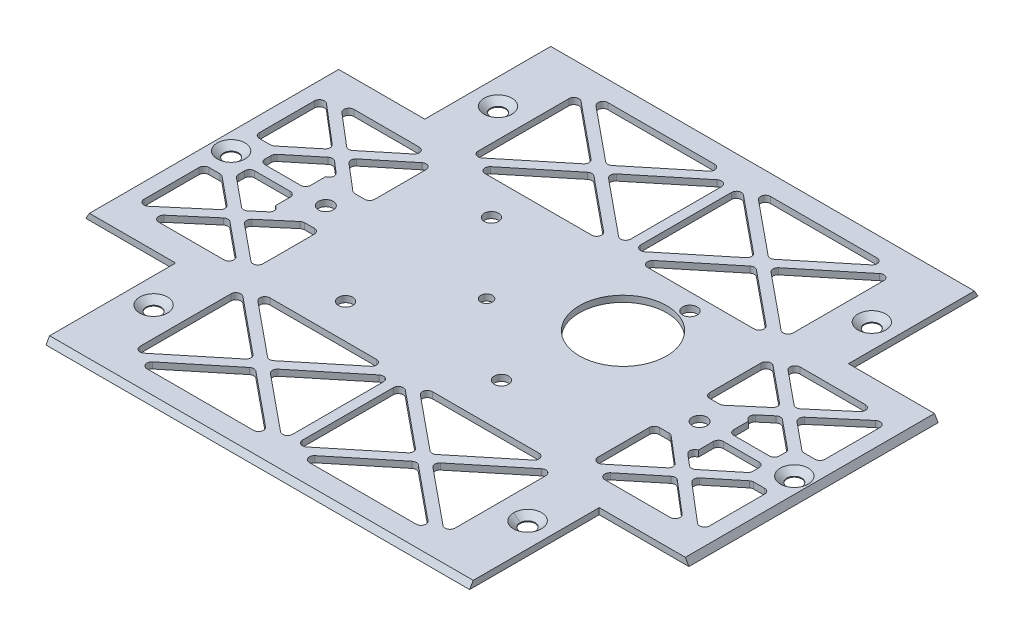
from build123d import *

# Parameters (mm, degrees)
SKETCH1_R                                 = 1.5
SKETCH1_R_2                               = 11.1125
SKETCH1_R_3                               = 1.89865
BOSS_EXTRUDE1_DEPTH                       = 1.5875
CSK_FOR_6_FLAT_HEAD_MACHINE_SCREW_2_COUNT = 2
CSK_FOR_6_FLAT_HEAD_MACHINE_SCREW_2_PITCH = 143.51
CSK_FOR_6_FLAT_HEAD_MACHINE_SCREW_3_COUNT = 2
CSK_FOR_6_FLAT_HEAD_MACHINE_SCREW_3_PITCH = 127.189783123
CSK_FOR_6_FLAT_HEAD_MACHINE_SCREW_4_COUNT = 2
CSK_FOR_6_FLAT_HEAD_MACHINE_SCREW_4_PITCH = 50.079071785
CSK_FOR_6_FLAT_HEAD_MACHINE_SCREW_5_COUNT = 2
CSK_FOR_6_FLAT_HEAD_MACHINE_SCREW_5_PITCH = 50.020107207
CSK_FOR_6_FLAT_HEAD_MACHINE_SCREW_6_COUNT = 2
CSK_FOR_6_FLAT_HEAD_MACHINE_SCREW_6_PITCH = 50.079071785
CSK_FOR_6_FLAT_HEAD_MACHINE_SCREW_7_COUNT = 2
CSK_FOR_6_FLAT_HEAD_MACHINE_SCREW_7_PITCH = 127.189783123
CUT_EXTRUDE6_DEPTH                        = 187.394464447
CUT_EXTRUDE7_DEPTH                        = 187.394464447
CUT_EXTRUDE8_DEPTH                        = 159.642852693
CUT_EXTRUDE9_DEPTH                        = 159.642852693
F_6_CLEARANCE_HOLE1_D                     = 3.6576
CUT_EXTRUDE12_DEPTH                       = 2.54
FILLET1_R                                 = 1.27
FILLET1_OF_MIRROR1_R                      = 1.27
MIRROR2_DEPTH                             = 1.5875


# Read off the part's stored shape, not the designer's step: Mirror2
with BuildPart() as part:
    # Sketch1 → Boss-Extrude1 (new body)
    with BuildSketch(Plane(origin=(0, 0, 0), x_dir=(1, 0, 0), z_dir=(0, 1, 0))):
        Polygon((27.777489681, 99.754696837), (4.917489681, 99.754696837), (4.917489681, 132.774696837), (-103.032510319, 132.774696837), (-103.032510319, 99.754696837), (-125.892510319, 99.754696837), (-125.892510319, 36.254696837), (-103.032510319, 36.254696837), (-103.032510319, 3.234696837), (4.917489681, 3.234696837), (4.917489681, 36.254696837), (27.777489681, 36.254696837), align=None)
        with Locations(Location((-55.534510319, 68.004696837, 0), (0, 0, 270))):
            Circle(SKETCH1_R, mode=Mode.SUBTRACT)
        with Locations(Location((-31.068010319, 78.308385275, 0), (0, 0, 270))):
            Circle(SKETCH1_R_2, mode=Mode.SUBTRACT)
        with Locations(Location((-1.305510319, 68.064393675, 0), (0, 0, 270))):
            Circle(SKETCH1_R_3, mode=Mode.SUBTRACT)
        with Locations(Location((-96.555510319, 68.064393675, 0), (0, 0, 270))):
            Circle(SKETCH1_R_3, mode=Mode.SUBTRACT)
    extrude(amount=BOSS_EXTRUDE1_DEPTH)

    # Sketch3 → CSK for #6 Flat Head Machine Screw (100)1 (revolve, cut)
    with BuildSketch(Plane(origin=(22.824489681, 1.5875, -68.064393675), x_dir=(0, 0, 1), z_dir=(1, 0, 0))):
        Polygon((0, 0), (0, 1.5875), (1.89865, 1.5875), (1.89865, 1.380025208), (3.5433, 0), align=None)
    csk_for_6_flat_head_machine_screw_100 = revolve(axis=Axis((22.824489681, 7.9375, -68.064393675), (0, -1, 0)), mode=Mode.SUBTRACT)

    # CSK for _6 Flat Head Machine Screw _ 2: CSK for #6 Flat Head Machine Screw (100)1 ×2
    with Locations(*[(-i * CSK_FOR_6_FLAT_HEAD_MACHINE_SCREW_2_PITCH, 0, 0) for i in range(1, CSK_FOR_6_FLAT_HEAD_MACHINE_SCREW_2_COUNT)]):
        add(csk_for_6_flat_head_machine_screw_100, mode=Mode.SUBTRACT)

    # CSK for _6 Flat Head Machine Screw _ 3: CSK for #6 Flat Head Machine Screw (100)1 ×2
    with Locations(*[Vector(-0.9385974019991601, 0, -0.3450143721070576) * (i * CSK_FOR_6_FLAT_HEAD_MACHINE_SCREW_3_PITCH) for i in range(1, CSK_FOR_6_FLAT_HEAD_MACHINE_SCREW_3_COUNT)]):
        add(csk_for_6_flat_head_machine_screw_100, mode=Mode.SUBTRACT)

    # CSK for _6 Flat Head Machine Screw _ 4: CSK for #6 Flat Head Machine Screw (100)1 ×2
    with Locations(*[Vector(-0.48183800417802863, 0, -0.8762603139077646) * (i * CSK_FOR_6_FLAT_HEAD_MACHINE_SCREW_4_PITCH) for i in range(1, CSK_FOR_6_FLAT_HEAD_MACHINE_SCREW_4_COUNT)]):
        add(csk_for_6_flat_head_machine_screw_100, mode=Mode.SUBTRACT)

    # CSK for _6 Flat Head Machine Screw _ 5: CSK for #6 Flat Head Machine Screw (100)1 ×2
    with Locations(*[Vector(-0.48240600325266964, 0, 0.8759477427482677) * (i * CSK_FOR_6_FLAT_HEAD_MACHINE_SCREW_5_PITCH) for i in range(1, CSK_FOR_6_FLAT_HEAD_MACHINE_SCREW_5_COUNT)]):
        add(csk_for_6_flat_head_machine_screw_100, mode=Mode.SUBTRACT)

    # CSK for _6 Flat Head Machine Screw _ 6: CSK for #6 Flat Head Machine Screw (100)1 ×2
    with Locations(*[Vector(-0.4818380041780274, 0, 0.8762603139077653) * (i * CSK_FOR_6_FLAT_HEAD_MACHINE_SCREW_6_PITCH) for i in range(1, CSK_FOR_6_FLAT_HEAD_MACHINE_SCREW_6_COUNT)]):
        add(csk_for_6_flat_head_machine_screw_100, mode=Mode.SUBTRACT)

    # CSK for _6 Flat Head Machine Screw _ 7: CSK for #6 Flat Head Machine Screw (100)1 ×2
    with Locations(*[Vector(-0.938597401999161, 0, 0.34501437210705527) * (i * CSK_FOR_6_FLAT_HEAD_MACHINE_SCREW_7_PITCH) for i in range(1, CSK_FOR_6_FLAT_HEAD_MACHINE_SCREW_7_COUNT)]):
        add(csk_for_6_flat_head_machine_screw_100, mode=Mode.SUBTRACT)

    # Sketch8 → Cut-Extrude6 (cut, through all)
    with BuildSketch(Plane(origin=(4.917489681, 0, 0), x_dir=(0, 0, -1), z_dir=(1, 0, 0))):
        Polygon((132.774696837, 0), (131.858153285, 1.5875), (132.774696837, 1.5875), align=None)
    extrude(amount=-CUT_EXTRUDE6_DEPTH, mode=Mode.SUBTRACT)

    # Sketch9 → Cut-Extrude7 (cut, through all)
    with BuildSketch(Plane(origin=(4.917489681, 0, 0), x_dir=(0, 0, -1), z_dir=(1, 0, 0))):
        Polygon((3.234696837, 0), (4.15124039, 1.5875), (3.234696837, 1.5875), align=None)
    extrude(amount=-CUT_EXTRUDE7_DEPTH, mode=Mode.SUBTRACT)

    # Sketch10 → Cut-Extrude8 (cut, through all)
    with BuildSketch(Plane.XY.offset(-36.254696837)):
        Polygon((-125.892510319, 0), (-124.975966766, 1.5875), (-125.892510319, 1.5875), align=None)
    extrude(amount=-CUT_EXTRUDE8_DEPTH, mode=Mode.SUBTRACT)

    # Sketch11 → Cut-Extrude9 (cut, through all)
    with BuildSketch(Plane.XY.offset(-36.254696837)):
        Polygon((27.777489681, 0), (26.860946129, 1.5875), (27.777489681, 1.5875), align=None)
    extrude(amount=-CUT_EXTRUDE9_DEPTH, mode=Mode.SUBTRACT)

    # #6 Clearance Hole1 (through all)
    with Locations(Plane(origin=(0, 1.5875, 0), x_dir=(1, 0, 0), z_dir=(0, 1, 0))):
        with Locations((-96.555510319, 24.182090512), (-72.908825938, 49.447641414), (-35.665374097, 51.922101675), (-1.305510319, 24.182090512), (-26.926442338, 91.200113333), (-72.874212511, 86.57747529), (-96.555510319, 111.946696837), (-1.305510319, 111.946696837)):
            Hole(F_6_CLEARANCE_HOLE1_D / 2)

    # Sketch17 → Cut-Extrude12 (cut)
    with BuildSketch(Plane(origin=(0, 1.5875, 0), x_dir=(1, 0, 0), z_dir=(0, 1, 0))):
        Polygon((-11.214289188, 126.742196837), (-45.498731449, 126.742196837), (-28.356510319, 112.72178858), align=None)
        Polygon((-30.362508382, 111.081107854), (-47.787510319, 125.332798995), (-47.787510319, 96.829416712), align=None)
        Polygon((-8.925510319, 125.332798995), (-26.350512255, 111.081107854), (-8.925510319, 96.829416712), align=None)
        Polygon((-11.214289188, 95.42001887), (-28.356510319, 109.440427127), (-45.498731449, 95.42001887), align=None)
        Polygon((5.996930497, 81.343177558), (-6.385510319, 91.470621028), (-6.385510319, 74.414393675), (-2.149673792, 74.414393675), align=None)
        Polygon((19.561515927, 92.88001887), (-4.096731449, 92.88001887), (7.963702644, 83.015940671), align=None)
        Polygon((16.474489681, 72.773712948), (7.995517321, 79.708558392), (1.770836956, 74.414393675), (4.850871649, 74.414393675), (4.850871649, 69.334393675), (16.474489681, 69.334393675), align=None)
        Polygon((23.014989681, 74.414393675), (23.014989681, 92.48279835), (9.962289468, 81.381321505), (18.480487745, 74.414393675), align=None)
    cut_extrude12 = extrude(amount=-CUT_EXTRUDE12_DEPTH, mode=Mode.SUBTRACT)

    # Fillet1
    # the kernel refuses this fillet: 1.27 mm, written as the material it adds along each edge
    with BuildSketch(Plane(origin=(-28.356510319, 1.5875, -109.440427127), x_dir=(0.7740689456064253, 0, 0.6331013089922947), z_dir=(0, -1, 0))) as fillet1_piece_1:
        with BuildLine():
            CenterArc((FILLET1_R * 0.817887492562, FILLET1_R), FILLET1_R, 191.441392135, 78.558607865)
            Line((-FILLET1_R * 0.162240632865, FILLET1_R * 0.801634534895), (-FILLET1_R * 0.181843195374, FILLET1_R * 0.797667225593))
            Line((-FILLET1_R * 0.181843195374, FILLET1_R * 0.797667225593), (-FILLET1_R * 0.0163577498512, -FILLET1_R * 0.02))
            Line((-FILLET1_R * 0.0163577498512, -FILLET1_R * 0.02), (FILLET1_R * 0.817887492562, -FILLET1_R * 0.02))
            Line((FILLET1_R * 0.817887492562, -FILLET1_R * 0.02), (FILLET1_R * 0.817887492562, 0))
        make_face()
    extrude(amount=1.5875)
    with BuildSketch(Plane(origin=(-11.214289188, 1.5875, -95.42001887), x_dir=(-1, 0, 0), z_dir=(0, -1, 0)), Plane(origin=(-11.214289188, 1.5875, -126.742196837), x_dir=(-0.7740689456064334, 0, 0.6331013089922848), z_dir=(0, -1, 0)), Plane(origin=(-45.498731449, 1.5875, -126.742196837), x_dir=(1, 0, 0), z_dir=(0, -1, 0)), Plane(origin=(-4.096731449, 1.5875, -92.88001887), x_dir=(1, 0, 0), z_dir=(0, -1, 0))) as fillet1_piece_2:
        with BuildLine():
            CenterArc((FILLET1_R * 2.8021880865, FILLET1_R), FILLET1_R, 129.279303932, 140.720696068)
            Line((FILLET1_R * 2.16908677751, FILLET1_R * 1.77406894561), (FILLET1_R * 2.15642475133, FILLET1_R * 1.78955032452))
            Line((FILLET1_R * 2.15642475133, FILLET1_R * 1.78955032452), (-FILLET1_R * 0.0126620261798, FILLET1_R * 0.0154813789121))
            Line((-FILLET1_R * 0.0126620261798, FILLET1_R * 0.0154813789121), (0, -FILLET1_R * 0.02))
            Line((0, -FILLET1_R * 0.02), (FILLET1_R * 2.8021880865, -FILLET1_R * 0.02))
            Line((FILLET1_R * 2.8021880865, -FILLET1_R * 0.02), (FILLET1_R * 2.8021880865, 0))
        make_face()
    extrude(amount=1.5875)
    with BuildSketch(Plane(origin=(-45.498731449, 1.5875, -95.42001887), x_dir=(1, 0, 0), z_dir=(0, -1, 0))) as fillet1_piece_3:
        with BuildLine():
            CenterArc((FILLET1_R * 2.8021880865, -FILLET1_R), FILLET1_R, 90, 140.720696068)
            Line((FILLET1_R * 2.16908677751, -FILLET1_R * 1.77406894561), (FILLET1_R * 2.15642475133, -FILLET1_R * 1.78955032452))
            Line((FILLET1_R * 2.15642475133, -FILLET1_R * 1.78955032452), (-FILLET1_R * 0.0126620261798, -FILLET1_R * 0.0154813789121))
            Line((-FILLET1_R * 0.0126620261798, -FILLET1_R * 0.0154813789121), (0, FILLET1_R * 0.02))
            Line((0, FILLET1_R * 0.02), (FILLET1_R * 2.8021880865, FILLET1_R * 0.02))
            Line((FILLET1_R * 2.8021880865, FILLET1_R * 0.02), (FILLET1_R * 2.8021880865, 0))
        make_face()
    extrude(amount=1.5875)
    with BuildSketch(Plane(origin=(-47.787510319, 1.5875, -125.332798995), x_dir=(0.774068945606431, 0, 0.6331013089922877), z_dir=(0, -1, 0)), Plane(origin=(-47.787510319, 1.5875, -96.829416712), x_dir=(0, 0, -1), z_dir=(0, -1, 0)), Plane(origin=(-8.925510319, 1.5875, -96.829416712), x_dir=(-0.7740689456064376, 0, -0.6331013089922797), z_dir=(0, -1, 0)), Plane(origin=(-6.385510319, 1.5875, -91.470621028), x_dir=(0.7740689456064331, 0, 0.633101308992285), z_dir=(0, -1, 0))) as fillet1_piece_4:
        with BuildLine():
            CenterArc((FILLET1_R * 2.10976208032, FILLET1_R), FILLET1_R, 140.720696068, 129.279303932)
            Line((FILLET1_R * 1.33569313471, FILLET1_R * 1.63310130899), (FILLET1_R * 1.3202117558, FILLET1_R * 1.64576333517))
            Line((FILLET1_R * 1.3202117558, FILLET1_R * 1.64576333517), (-FILLET1_R * 0.0154813789121, FILLET1_R * 0.0126620261798))
            Line((-FILLET1_R * 0.0154813789121, FILLET1_R * 0.0126620261798), (0, -FILLET1_R * 0.02))
            Line((0, -FILLET1_R * 0.02), (FILLET1_R * 2.10976208032, -FILLET1_R * 0.02))
            Line((FILLET1_R * 2.10976208032, -FILLET1_R * 0.02), (FILLET1_R * 2.10976208032, 0))
        make_face()
    extrude(amount=1.5875)
    with BuildSketch(Plane(origin=(-30.362508382, 1.5875, -111.081107854), x_dir=(-0.7740689456064327, 0, -0.6331013089922857), z_dir=(0, -1, 0))) as fillet1_piece_5:
        with BuildLine():
            CenterArc((FILLET1_R * 1.22266205205, -FILLET1_R), FILLET1_R, 90, 101.441392135)
            Line((FILLET1_R * 0.24253392662, -FILLET1_R * 1.1983654651), (FILLET1_R * 0.222931364111, -FILLET1_R * 1.20233277441))
            Line((FILLET1_R * 0.222931364111, -FILLET1_R * 1.20233277441), (-FILLET1_R * 0.0244532410409, FILLET1_R * 0.02))
            Line((-FILLET1_R * 0.0244532410409, FILLET1_R * 0.02), (FILLET1_R * 1.22266205205, FILLET1_R * 0.02))
            Line((FILLET1_R * 1.22266205205, FILLET1_R * 0.02), (FILLET1_R * 1.22266205205, 0))
        make_face()
    extrude(amount=1.5875)
    with BuildSketch(Plane(origin=(-28.356510319, 1.5875, -112.72178858), x_dir=(0.7740689456064334, 0, -0.6331013089922848), z_dir=(0, -1, 0))) as fillet1_piece_6:
        with BuildLine():
            CenterArc((FILLET1_R * 0.817887492562, -FILLET1_R), FILLET1_R, 90, 78.558607865)
            Line((-FILLET1_R * 0.162240632865, -FILLET1_R * 0.801634534895), (-FILLET1_R * 0.181843195374, -FILLET1_R * 0.797667225593))
            Line((-FILLET1_R * 0.181843195374, -FILLET1_R * 0.797667225593), (-FILLET1_R * 0.0163577498512, FILLET1_R * 0.02))
            Line((-FILLET1_R * 0.0163577498512, FILLET1_R * 0.02), (FILLET1_R * 0.817887492562, FILLET1_R * 0.02))
            Line((FILLET1_R * 0.817887492562, FILLET1_R * 0.02), (FILLET1_R * 0.817887492562, 0))
        make_face()
    extrude(amount=1.5875)
    with BuildSketch(Plane(origin=(-8.925510319, 1.5875, -125.332798995), x_dir=(-0.7740689456064339, 0, 0.633101308992284), z_dir=(0, -1, 0))) as fillet1_piece_7:
        with BuildLine():
            CenterArc((FILLET1_R * 2.10976208032, -FILLET1_R), FILLET1_R, 90, 129.279303932)
            Line((FILLET1_R * 1.33569313471, -FILLET1_R * 1.63310130899), (FILLET1_R * 1.3202117558, -FILLET1_R * 1.64576333517))
            Line((FILLET1_R * 1.3202117558, -FILLET1_R * 1.64576333517), (-FILLET1_R * 0.0154813789121, -FILLET1_R * 0.0126620261798))
            Line((-FILLET1_R * 0.0154813789121, -FILLET1_R * 0.0126620261798), (0, FILLET1_R * 0.02))
            Line((0, FILLET1_R * 0.02), (FILLET1_R * 2.10976208032, FILLET1_R * 0.02))
            Line((FILLET1_R * 2.10976208032, FILLET1_R * 0.02), (FILLET1_R * 2.10976208032, 0))
        make_face()
    extrude(amount=1.5875)
    with BuildSketch(Plane(origin=(-26.350512255, 1.5875, -111.081107854), x_dir=(0.7740689456064362, 0, -0.6331013089922812), z_dir=(0, -1, 0))) as fillet1_piece_8:
        with BuildLine():
            CenterArc((FILLET1_R * 1.22266205205, FILLET1_R), FILLET1_R, 168.558607865, 101.441392135)
            Line((FILLET1_R * 0.24253392662, FILLET1_R * 1.1983654651), (FILLET1_R * 0.222931364111, FILLET1_R * 1.20233277441))
            Line((FILLET1_R * 0.222931364111, FILLET1_R * 1.20233277441), (-FILLET1_R * 0.0244532410409, -FILLET1_R * 0.02))
            Line((-FILLET1_R * 0.0244532410409, -FILLET1_R * 0.02), (FILLET1_R * 1.22266205205, -FILLET1_R * 0.02))
            Line((FILLET1_R * 1.22266205205, -FILLET1_R * 0.02), (FILLET1_R * 1.22266205205, 0))
        make_face()
    extrude(amount=1.5875)
    with BuildSketch(Plane(origin=(7.963702644, 1.5875, -83.015940671), x_dir=(0.761746862196503, 0, -0.6478747702556271), z_dir=(0, -1, 0))) as fillet1_piece_9:
        with BuildLine():
            CenterArc((FILLET1_R * 0.834068820453, -FILLET1_R), FILLET1_R, 90, 79.660863576)
            Line((-FILLET1_R * 0.149693855421, -FILLET1_R * 0.820525774672), (-FILLET1_R * 0.169369108938, -FILLET1_R * 0.816936290166))
            Line((-FILLET1_R * 0.169369108938, -FILLET1_R * 0.816936290166), (-FILLET1_R * 0.0166813764091, FILLET1_R * 0.02))
            Line((-FILLET1_R * 0.0166813764091, FILLET1_R * 0.02), (FILLET1_R * 0.834068820453, FILLET1_R * 0.02))
            Line((FILLET1_R * 0.834068820453, FILLET1_R * 0.02), (FILLET1_R * 0.834068820453, 0))
        make_face()
    extrude(amount=1.5875)
    with BuildSketch(Plane(origin=(19.561515927, 1.5875, -92.88001887), x_dir=(-0.7617468621965059, 0, 0.6478747702556239), z_dir=(0, -1, 0))) as fillet1_piece_10:
        with BuildLine():
            CenterArc((FILLET1_R * 2.71927067248, FILLET1_R), FILLET1_R, 130.381559644, 139.618440356)
            Line((FILLET1_R * 2.07139590223, FILLET1_R * 1.7617468622), (FILLET1_R * 2.05843840682, FILLET1_R * 1.77698179944))
            Line((FILLET1_R * 2.05843840682, FILLET1_R * 1.77698179944), (-FILLET1_R * 0.0129574954051, FILLET1_R * 0.0152349372439))
            Line((-FILLET1_R * 0.0129574954051, FILLET1_R * 0.0152349372439), (0, -FILLET1_R * 0.02))
            Line((0, -FILLET1_R * 0.02), (FILLET1_R * 2.71927067248, -FILLET1_R * 0.02))
            Line((FILLET1_R * 2.71927067248, -FILLET1_R * 0.02), (FILLET1_R * 2.71927067248, 0))
        make_face()
    extrude(amount=1.5875)
    with BuildSketch(Plane(origin=(-2.149673792, 1.5875, -74.414393675), x_dir=(-1, 0, 0), z_dir=(0, -1, 0))) as fillet1_piece_11:
        with BuildLine():
            CenterArc((FILLET1_R * 0.36774566435, FILLET1_R), FILLET1_R, 229.618440356, 40.381559644)
            Line((-FILLET1_R * 0.280129105905, FILLET1_R * 0.238253137803), (-FILLET1_R * 0.29308660131, FILLET1_R * 0.22301820056))
            Line((-FILLET1_R * 0.29308660131, FILLET1_R * 0.22301820056), (-FILLET1_R * 0.00735491328701, -FILLET1_R * 0.02))
            Line((-FILLET1_R * 0.00735491328701, -FILLET1_R * 0.02), (FILLET1_R * 0.36774566435, -FILLET1_R * 0.02))
            Line((FILLET1_R * 0.36774566435, -FILLET1_R * 0.02), (FILLET1_R * 0.36774566435, 0))
        make_face()
    extrude(amount=1.5875)
    with BuildSketch(Plane(origin=(-6.385510319, 1.5875, -74.414393675), x_dir=(0, 0, -1), z_dir=(0, -1, 0)), Plane(origin=(16.474489681, 1.5875, -69.334393675), x_dir=(-1, 0, 0), z_dir=(0, -1, 0)), Plane(origin=(23.014989681, 1.5875, -74.414393675), x_dir=(-1, 0, 0), z_dir=(0, -1, 0))) as fillet1_piece_12:
        with BuildLine():
            CenterArc((FILLET1_R, FILLET1_R), FILLET1_R, 180, 90)
            Line((0, FILLET1_R), (-FILLET1_R * 0.02, FILLET1_R))
            Line((-FILLET1_R * 0.02, FILLET1_R), (-FILLET1_R * 0.02, -FILLET1_R * 0.02))
            Line((-FILLET1_R * 0.02, -FILLET1_R * 0.02), (FILLET1_R, -FILLET1_R * 0.02))
            Line((FILLET1_R, -FILLET1_R * 0.02), (FILLET1_R, 0))
        make_face()
    extrude(amount=1.5875)
    with BuildSketch(Plane(origin=(5.996930497, 1.5875, -81.343177558), x_dir=(-0.7740689456064349, 0, -0.6331013089922829), z_dir=(0, -1, 0)), Plane(origin=(9.962289468, 1.5875, -81.381321505), x_dir=(0.7740689456064364, 0, 0.6331013089922812), z_dir=(0, -1, 0))) as fillet1_piece_13:
        with BuildLine():
            CenterArc((FILLET1_R * 1.19894183247, -FILLET1_R), FILLET1_R, 90, 100.339136424)
            Line((FILLET1_R * 0.215179156595, -FILLET1_R * 1.17947422533), (FILLET1_R * 0.195503903078, -FILLET1_R * 1.18306370983))
            Line((FILLET1_R * 0.195503903078, -FILLET1_R * 1.18306370983), (-FILLET1_R * 0.0239788366494, FILLET1_R * 0.02))
            Line((-FILLET1_R * 0.0239788366494, FILLET1_R * 0.02), (FILLET1_R * 1.19894183247, FILLET1_R * 0.02))
            Line((FILLET1_R * 1.19894183247, FILLET1_R * 0.02), (FILLET1_R * 1.19894183247, 0))
        make_face()
    extrude(amount=1.5875)
    with BuildSketch(Plane(origin=(1.770836956, 1.5875, -74.414393675), x_dir=(0.761746862196506, 0, -0.6478747702556238), z_dir=(0, -1, 0))) as fillet1_piece_14:
        with BuildLine():
            CenterArc((3.388599902, 1.27), FILLET1_R, 145.163151705, 124.836848295)
            Line((2.346206763, 1.995476769), (2.3253589, 2.009986304))
            ThreePointArc((2.3253589, 2.009986304), (1.156647362, 1.017086755), (-0.016456019, 0.01934837))
            Line((-0.016456019, 0.01934837), (0, -0.0254))
            Line((0, -0.0254), (3.388599902, -0.0254))
            Line((3.388599902, -0.0254), (3.388599902, 0))
        make_face()
    extrude(amount=1.5875)
    with BuildSketch(Plane(origin=(7.995517321, 1.5875, -79.708558392), x_dir=(0.7740689456064308, 0, 0.633101308992288), z_dir=(0, -1, 0))) as fillet1_piece_15:
        with BuildLine():
            CenterArc((FILLET1_R * 0.834068820453, FILLET1_R), FILLET1_R, 190.339136424, 79.660863576)
            Line((-FILLET1_R * 0.149693855421, FILLET1_R * 0.820525774672), (-FILLET1_R * 0.169369108938, FILLET1_R * 0.816936290166))
            Line((-FILLET1_R * 0.169369108938, FILLET1_R * 0.816936290166), (-FILLET1_R * 0.0166813764091, -FILLET1_R * 0.02))
            Line((-FILLET1_R * 0.0166813764091, -FILLET1_R * 0.02), (FILLET1_R * 0.834068820453, -FILLET1_R * 0.02))
            Line((FILLET1_R * 0.834068820453, -FILLET1_R * 0.02), (FILLET1_R * 0.834068820453, 0))
        make_face()
    extrude(amount=1.5875)
    with BuildSketch(Plane(origin=(16.474489681, 1.5875, -72.773712948), x_dir=(0, 0, 1), z_dir=(0, -1, 0))) as fillet1_piece_16:
        with BuildLine():
            CenterArc((FILLET1_R * 0.473987095194, FILLET1_R), FILLET1_R, 219.279303932, 50.720696068)
            Line((-FILLET1_R * 0.300081850413, FILLET1_R * 0.366898691008), (-FILLET1_R * 0.315563229325, FILLET1_R * 0.354236664828))
            Line((-FILLET1_R * 0.315563229325, FILLET1_R * 0.354236664828), (-FILLET1_R * 0.00947974190387, -FILLET1_R * 0.02))
            Line((-FILLET1_R * 0.00947974190387, -FILLET1_R * 0.02), (FILLET1_R * 0.473987095194, -FILLET1_R * 0.02))
            Line((FILLET1_R * 0.473987095194, -FILLET1_R * 0.02), (FILLET1_R * 0.473987095194, 0))
        make_face()
    extrude(amount=1.5875)
    with BuildSketch(Plane(origin=(4.850871649, 1.5875, -69.334393675), x_dir=(1, 0, 0), z_dir=(0, -1, 0))) as fillet1_piece_17:
        with BuildLine():
            CenterArc((FILLET1_R, -FILLET1_R), FILLET1_R, 90, 90)
            Line((0, -FILLET1_R), (-FILLET1_R * 0.02, -FILLET1_R))
            Line((-FILLET1_R * 0.02, -FILLET1_R), (-FILLET1_R * 0.02, FILLET1_R * 0.02))
            Line((-FILLET1_R * 0.02, FILLET1_R * 0.02), (FILLET1_R, FILLET1_R * 0.02))
            Line((FILLET1_R, FILLET1_R * 0.02), (FILLET1_R, 0))
        make_face()
    extrude(amount=1.5875)
    with BuildSketch(Plane(origin=(18.480487745, 1.5875, -74.414393675), x_dir=(-0.7740689456064446, 0, -0.633101308992271), z_dir=(0, -1, 0))) as fillet1_piece_18:
        with BuildLine():
            CenterArc((FILLET1_R * 0.356863982406, FILLET1_R), FILLET1_R, 230.720696068, 39.279303932)
            Line((-FILLET1_R * 0.276237326586, FILLET1_R * 0.225931054394), (-FILLET1_R * 0.288899352766, FILLET1_R * 0.210449675481))
            Line((-FILLET1_R * 0.288899352766, FILLET1_R * 0.210449675481), (-FILLET1_R * 0.00713727964813, -FILLET1_R * 0.02))
            Line((-FILLET1_R * 0.00713727964813, -FILLET1_R * 0.02), (FILLET1_R * 0.356863982406, -FILLET1_R * 0.02))
            Line((FILLET1_R * 0.356863982406, -FILLET1_R * 0.02), (FILLET1_R * 0.356863982406, 0))
        make_face()
    extrude(amount=1.5875)
    with BuildSketch(Plane(origin=(23.014989681, 1.5875, -92.48279835), x_dir=(0, 0, 1), z_dir=(0, -1, 0))) as fillet1_piece_19:
        with BuildLine():
            CenterArc((FILLET1_R * 2.16328396221, FILLET1_R), FILLET1_R, 139.618440356, 130.381559644)
            Line((FILLET1_R * 1.40153710002, FILLET1_R * 1.64787477026), (FILLET1_R * 1.38630216277, FILLET1_R * 1.66083226566))
            Line((FILLET1_R * 1.38630216277, FILLET1_R * 1.66083226566), (-FILLET1_R * 0.0152349372439, FILLET1_R * 0.0129574954051))
            Line((-FILLET1_R * 0.0152349372439, FILLET1_R * 0.0129574954051), (0, -FILLET1_R * 0.02))
            Line((0, -FILLET1_R * 0.02), (FILLET1_R * 2.16328396221, -FILLET1_R * 0.02))
            Line((FILLET1_R * 2.16328396221, -FILLET1_R * 0.02), (FILLET1_R * 2.16328396221, 0))
        make_face()
    extrude(amount=1.5875)

    # Mirror1: Cut-Extrude12 across plane
    add(cut_extrude12.mirror(Plane(origin=(-49.057510319, 0, -132.774696837), x_dir=(0, 0, 1), z_dir=(1, 0, 0))), mode=Mode.SUBTRACT)

    # Fillet1 of Mirror1
    # the kernel refuses this fillet: 1.27 mm, written as the material it adds along each edge
    with BuildSketch(Plane(origin=(-69.758510319, 1.5875, -109.440427127), x_dir=(0.7740689456064253, 0, 0.6331013089922947), z_dir=(0, -1, 0))) as fillet1_of_mirror1_piece_1:
        with BuildLine():
            CenterArc((FILLET1_OF_MIRROR1_R * 0.817887492562, FILLET1_OF_MIRROR1_R), FILLET1_OF_MIRROR1_R, 191.441392135, 78.558607865)
            Line((-FILLET1_OF_MIRROR1_R * 0.162240632865, FILLET1_OF_MIRROR1_R * 0.801634534895), (-FILLET1_OF_MIRROR1_R * 0.181843195374, FILLET1_OF_MIRROR1_R * 0.797667225593))
            Line((-FILLET1_OF_MIRROR1_R * 0.181843195374, FILLET1_OF_MIRROR1_R * 0.797667225593), (-FILLET1_OF_MIRROR1_R * 0.0163577498512, -FILLET1_OF_MIRROR1_R * 0.02))
            Line((-FILLET1_OF_MIRROR1_R * 0.0163577498512, -FILLET1_OF_MIRROR1_R * 0.02), (FILLET1_OF_MIRROR1_R * 0.817887492562, -FILLET1_OF_MIRROR1_R * 0.02))
            Line((FILLET1_OF_MIRROR1_R * 0.817887492562, -FILLET1_OF_MIRROR1_R * 0.02), (FILLET1_OF_MIRROR1_R * 0.817887492562, 0))
        make_face()
    extrude(amount=1.5875)
    with BuildSketch(Plane(origin=(-86.900731449, 1.5875, -95.42001887), x_dir=(0.7740689456064318, 0, -0.6331013089922868), z_dir=(0, -1, 0)), Plane(origin=(-86.900731449, 1.5875, -126.742196837), x_dir=(1, 0, 0), z_dir=(0, -1, 0)), Plane(origin=(-52.616289188, 1.5875, -126.742196837), x_dir=(-0.774068945606437, 0, 0.6331013089922803), z_dir=(0, -1, 0)), Plane(origin=(-94.018289188, 1.5875, -92.88001887), x_dir=(-0.7740689456064342, 0, 0.6331013089922837), z_dir=(0, -1, 0))) as fillet1_of_mirror1_piece_2:
        with BuildLine():
            CenterArc((FILLET1_OF_MIRROR1_R * 2.8021880865, FILLET1_OF_MIRROR1_R), FILLET1_OF_MIRROR1_R, 129.279303932, 140.720696068)
            Line((FILLET1_OF_MIRROR1_R * 2.16908677751, FILLET1_OF_MIRROR1_R * 1.77406894561), (FILLET1_OF_MIRROR1_R * 2.15642475133, FILLET1_OF_MIRROR1_R * 1.78955032452))
            Line((FILLET1_OF_MIRROR1_R * 2.15642475133, FILLET1_OF_MIRROR1_R * 1.78955032452), (-FILLET1_OF_MIRROR1_R * 0.0126620261798, FILLET1_OF_MIRROR1_R * 0.0154813789121))
            Line((-FILLET1_OF_MIRROR1_R * 0.0126620261798, FILLET1_OF_MIRROR1_R * 0.0154813789121), (0, -FILLET1_OF_MIRROR1_R * 0.02))
            Line((0, -FILLET1_OF_MIRROR1_R * 0.02), (FILLET1_OF_MIRROR1_R * 2.8021880865, -FILLET1_OF_MIRROR1_R * 0.02))
            Line((FILLET1_OF_MIRROR1_R * 2.8021880865, -FILLET1_OF_MIRROR1_R * 0.02), (FILLET1_OF_MIRROR1_R * 2.8021880865, 0))
        make_face()
    extrude(amount=1.5875)
    with BuildSketch(Plane(origin=(-52.616289188, 1.5875, -95.42001887), x_dir=(-0.7740689456064346, 0, -0.6331013089922835), z_dir=(0, -1, 0))) as fillet1_of_mirror1_piece_3:
        with BuildLine():
            CenterArc((FILLET1_OF_MIRROR1_R * 2.8021880865, -FILLET1_OF_MIRROR1_R), FILLET1_OF_MIRROR1_R, 90, 140.720696068)
            Line((FILLET1_OF_MIRROR1_R * 2.16908677751, -FILLET1_OF_MIRROR1_R * 1.77406894561), (FILLET1_OF_MIRROR1_R * 2.15642475133, -FILLET1_OF_MIRROR1_R * 1.78955032452))
            Line((FILLET1_OF_MIRROR1_R * 2.15642475133, -FILLET1_OF_MIRROR1_R * 1.78955032452), (-FILLET1_OF_MIRROR1_R * 0.0126620261798, -FILLET1_OF_MIRROR1_R * 0.0154813789121))
            Line((-FILLET1_OF_MIRROR1_R * 0.0126620261798, -FILLET1_OF_MIRROR1_R * 0.0154813789121), (0, FILLET1_OF_MIRROR1_R * 0.02))
            Line((0, FILLET1_OF_MIRROR1_R * 0.02), (FILLET1_OF_MIRROR1_R * 2.8021880865, FILLET1_OF_MIRROR1_R * 0.02))
            Line((FILLET1_OF_MIRROR1_R * 2.8021880865, FILLET1_OF_MIRROR1_R * 0.02), (FILLET1_OF_MIRROR1_R * 2.8021880865, 0))
        make_face()
    extrude(amount=1.5875)
    with BuildSketch(Plane(origin=(-50.327510319, 1.5875, -125.332798995), x_dir=(0, 0, 1), z_dir=(0, -1, 0)), Plane(origin=(-50.327510319, 1.5875, -96.829416712), x_dir=(-0.7740689456064358, 0, -0.6331013089922819), z_dir=(0, -1, 0)), Plane(origin=(-89.189510319, 1.5875, -96.829416712), x_dir=(0, 0, -1), z_dir=(0, -1, 0)), Plane(origin=(-91.729510319, 1.5875, -91.470621028), x_dir=(0, 0, 1), z_dir=(0, -1, 0))) as fillet1_of_mirror1_piece_4:
        with BuildLine():
            CenterArc((FILLET1_OF_MIRROR1_R * 2.10976208032, FILLET1_OF_MIRROR1_R), FILLET1_OF_MIRROR1_R, 140.720696068, 129.279303932)
            Line((FILLET1_OF_MIRROR1_R * 1.33569313471, FILLET1_OF_MIRROR1_R * 1.63310130899), (FILLET1_OF_MIRROR1_R * 1.3202117558, FILLET1_OF_MIRROR1_R * 1.64576333517))
            Line((FILLET1_OF_MIRROR1_R * 1.3202117558, FILLET1_OF_MIRROR1_R * 1.64576333517), (-FILLET1_OF_MIRROR1_R * 0.0154813789121, FILLET1_OF_MIRROR1_R * 0.0126620261798))
            Line((-FILLET1_OF_MIRROR1_R * 0.0154813789121, FILLET1_OF_MIRROR1_R * 0.0126620261798), (0, -FILLET1_OF_MIRROR1_R * 0.02))
            Line((0, -FILLET1_OF_MIRROR1_R * 0.02), (FILLET1_OF_MIRROR1_R * 2.10976208032, -FILLET1_OF_MIRROR1_R * 0.02))
            Line((FILLET1_OF_MIRROR1_R * 2.10976208032, -FILLET1_OF_MIRROR1_R * 0.02), (FILLET1_OF_MIRROR1_R * 2.10976208032, 0))
        make_face()
    extrude(amount=1.5875)
    with BuildSketch(Plane(origin=(-67.752512255, 1.5875, -111.081107854), x_dir=(0.774068945606437, 0, 0.6331013089922802), z_dir=(0, -1, 0))) as fillet1_of_mirror1_piece_5:
        with BuildLine():
            CenterArc((FILLET1_OF_MIRROR1_R * 1.22266205205, -FILLET1_OF_MIRROR1_R), FILLET1_OF_MIRROR1_R, 90, 101.441392135)
            Line((FILLET1_OF_MIRROR1_R * 0.24253392662, -FILLET1_OF_MIRROR1_R * 1.1983654651), (FILLET1_OF_MIRROR1_R * 0.222931364111, -FILLET1_OF_MIRROR1_R * 1.20233277441))
            Line((FILLET1_OF_MIRROR1_R * 0.222931364111, -FILLET1_OF_MIRROR1_R * 1.20233277441), (-FILLET1_OF_MIRROR1_R * 0.0244532410409, FILLET1_OF_MIRROR1_R * 0.02))
            Line((-FILLET1_OF_MIRROR1_R * 0.0244532410409, FILLET1_OF_MIRROR1_R * 0.02), (FILLET1_OF_MIRROR1_R * 1.22266205205, FILLET1_OF_MIRROR1_R * 0.02))
            Line((FILLET1_OF_MIRROR1_R * 1.22266205205, FILLET1_OF_MIRROR1_R * 0.02), (FILLET1_OF_MIRROR1_R * 1.22266205205, 0))
        make_face()
    extrude(amount=1.5875)
    with BuildSketch(Plane(origin=(-69.758510319, 1.5875, -112.72178858), x_dir=(0.7740689456064332, 0, -0.633101308992285), z_dir=(0, -1, 0))) as fillet1_of_mirror1_piece_6:
        with BuildLine():
            CenterArc((FILLET1_OF_MIRROR1_R * 0.817887492562, -FILLET1_OF_MIRROR1_R), FILLET1_OF_MIRROR1_R, 90, 78.558607865)
            Line((-FILLET1_OF_MIRROR1_R * 0.162240632865, -FILLET1_OF_MIRROR1_R * 0.801634534895), (-FILLET1_OF_MIRROR1_R * 0.181843195374, -FILLET1_OF_MIRROR1_R * 0.797667225593))
            Line((-FILLET1_OF_MIRROR1_R * 0.181843195374, -FILLET1_OF_MIRROR1_R * 0.797667225593), (-FILLET1_OF_MIRROR1_R * 0.0163577498512, FILLET1_OF_MIRROR1_R * 0.02))
            Line((-FILLET1_OF_MIRROR1_R * 0.0163577498512, FILLET1_OF_MIRROR1_R * 0.02), (FILLET1_OF_MIRROR1_R * 0.817887492562, FILLET1_OF_MIRROR1_R * 0.02))
            Line((FILLET1_OF_MIRROR1_R * 0.817887492562, FILLET1_OF_MIRROR1_R * 0.02), (FILLET1_OF_MIRROR1_R * 0.817887492562, 0))
        make_face()
    extrude(amount=1.5875)
    with BuildSketch(Plane(origin=(-89.189510319, 1.5875, -125.332798995), x_dir=(0, 0, 1), z_dir=(0, -1, 0))) as fillet1_of_mirror1_piece_7:
        with BuildLine():
            CenterArc((FILLET1_OF_MIRROR1_R * 2.10976208032, -FILLET1_OF_MIRROR1_R), FILLET1_OF_MIRROR1_R, 90, 129.279303932)
            Line((FILLET1_OF_MIRROR1_R * 1.33569313471, -FILLET1_OF_MIRROR1_R * 1.63310130899), (FILLET1_OF_MIRROR1_R * 1.3202117558, -FILLET1_OF_MIRROR1_R * 1.64576333517))
            Line((FILLET1_OF_MIRROR1_R * 1.3202117558, -FILLET1_OF_MIRROR1_R * 1.64576333517), (-FILLET1_OF_MIRROR1_R * 0.0154813789121, -FILLET1_OF_MIRROR1_R * 0.0126620261798))
            Line((-FILLET1_OF_MIRROR1_R * 0.0154813789121, -FILLET1_OF_MIRROR1_R * 0.0126620261798), (0, FILLET1_OF_MIRROR1_R * 0.02))
            Line((0, FILLET1_OF_MIRROR1_R * 0.02), (FILLET1_OF_MIRROR1_R * 2.10976208032, FILLET1_OF_MIRROR1_R * 0.02))
            Line((FILLET1_OF_MIRROR1_R * 2.10976208032, FILLET1_OF_MIRROR1_R * 0.02), (FILLET1_OF_MIRROR1_R * 2.10976208032, 0))
        make_face()
    extrude(amount=1.5875)
    with BuildSketch(Plane(origin=(-71.764508382, 1.5875, -111.081107854), x_dir=(-0.7740689456064362, 0, 0.6331013089922812), z_dir=(0, -1, 0))) as fillet1_of_mirror1_piece_8:
        with BuildLine():
            CenterArc((FILLET1_OF_MIRROR1_R * 1.22266205205, FILLET1_OF_MIRROR1_R), FILLET1_OF_MIRROR1_R, 168.558607865, 101.441392135)
            Line((FILLET1_OF_MIRROR1_R * 0.24253392662, FILLET1_OF_MIRROR1_R * 1.1983654651), (FILLET1_OF_MIRROR1_R * 0.222931364111, FILLET1_OF_MIRROR1_R * 1.20233277441))
            Line((FILLET1_OF_MIRROR1_R * 0.222931364111, FILLET1_OF_MIRROR1_R * 1.20233277441), (-FILLET1_OF_MIRROR1_R * 0.0244532410409, -FILLET1_OF_MIRROR1_R * 0.02))
            Line((-FILLET1_OF_MIRROR1_R * 0.0244532410409, -FILLET1_OF_MIRROR1_R * 0.02), (FILLET1_OF_MIRROR1_R * 1.22266205205, -FILLET1_OF_MIRROR1_R * 0.02))
            Line((FILLET1_OF_MIRROR1_R * 1.22266205205, -FILLET1_OF_MIRROR1_R * 0.02), (FILLET1_OF_MIRROR1_R * 1.22266205205, 0))
        make_face()
    extrude(amount=1.5875)
    with BuildSketch(Plane(origin=(-106.078723281, 1.5875, -83.015940671), x_dir=(0.7740689456064417, 0, -0.6331013089922747), z_dir=(0, -1, 0))) as fillet1_of_mirror1_piece_9:
        with BuildLine():
            CenterArc((FILLET1_OF_MIRROR1_R * 0.834068820453, -FILLET1_OF_MIRROR1_R), FILLET1_OF_MIRROR1_R, 90, 79.660863576)
            Line((-FILLET1_OF_MIRROR1_R * 0.149693855421, -FILLET1_OF_MIRROR1_R * 0.820525774672), (-FILLET1_OF_MIRROR1_R * 0.169369108938, -FILLET1_OF_MIRROR1_R * 0.816936290166))
            Line((-FILLET1_OF_MIRROR1_R * 0.169369108938, -FILLET1_OF_MIRROR1_R * 0.816936290166), (-FILLET1_OF_MIRROR1_R * 0.0166813764091, FILLET1_OF_MIRROR1_R * 0.02))
            Line((-FILLET1_OF_MIRROR1_R * 0.0166813764091, FILLET1_OF_MIRROR1_R * 0.02), (FILLET1_OF_MIRROR1_R * 0.834068820453, FILLET1_OF_MIRROR1_R * 0.02))
            Line((FILLET1_OF_MIRROR1_R * 0.834068820453, FILLET1_OF_MIRROR1_R * 0.02), (FILLET1_OF_MIRROR1_R * 0.834068820453, 0))
        make_face()
    extrude(amount=1.5875)
    with BuildSketch(Plane(origin=(-117.676536565, 1.5875, -92.88001887), x_dir=(1, 0, 0), z_dir=(0, -1, 0))) as fillet1_of_mirror1_piece_10:
        with BuildLine():
            CenterArc((FILLET1_OF_MIRROR1_R * 2.71927067248, FILLET1_OF_MIRROR1_R), FILLET1_OF_MIRROR1_R, 130.381559644, 139.618440356)
            Line((FILLET1_OF_MIRROR1_R * 2.07139590223, FILLET1_OF_MIRROR1_R * 1.7617468622), (FILLET1_OF_MIRROR1_R * 2.05843840682, FILLET1_OF_MIRROR1_R * 1.77698179944))
            Line((FILLET1_OF_MIRROR1_R * 2.05843840682, FILLET1_OF_MIRROR1_R * 1.77698179944), (-FILLET1_OF_MIRROR1_R * 0.0129574954051, FILLET1_OF_MIRROR1_R * 0.0152349372439))
            Line((-FILLET1_OF_MIRROR1_R * 0.0129574954051, FILLET1_OF_MIRROR1_R * 0.0152349372439), (0, -FILLET1_OF_MIRROR1_R * 0.02))
            Line((0, -FILLET1_OF_MIRROR1_R * 0.02), (FILLET1_OF_MIRROR1_R * 2.71927067248, -FILLET1_OF_MIRROR1_R * 0.02))
            Line((FILLET1_OF_MIRROR1_R * 2.71927067248, -FILLET1_OF_MIRROR1_R * 0.02), (FILLET1_OF_MIRROR1_R * 2.71927067248, 0))
        make_face()
    extrude(amount=1.5875)
    with BuildSketch(Plane(origin=(-95.965346846, 1.5875, -74.414393675), x_dir=(-0.7617468621965019, 0, -0.6478747702556286), z_dir=(0, -1, 0))) as fillet1_of_mirror1_piece_11:
        with BuildLine():
            CenterArc((FILLET1_OF_MIRROR1_R * 0.36774566435, FILLET1_OF_MIRROR1_R), FILLET1_OF_MIRROR1_R, 229.618440356, 40.381559644)
            Line((-FILLET1_OF_MIRROR1_R * 0.280129105905, FILLET1_OF_MIRROR1_R * 0.238253137803), (-FILLET1_OF_MIRROR1_R * 0.29308660131, FILLET1_OF_MIRROR1_R * 0.22301820056))
            Line((-FILLET1_OF_MIRROR1_R * 0.29308660131, FILLET1_OF_MIRROR1_R * 0.22301820056), (-FILLET1_OF_MIRROR1_R * 0.00735491328701, -FILLET1_OF_MIRROR1_R * 0.02))
            Line((-FILLET1_OF_MIRROR1_R * 0.00735491328701, -FILLET1_OF_MIRROR1_R * 0.02), (FILLET1_OF_MIRROR1_R * 0.36774566435, -FILLET1_OF_MIRROR1_R * 0.02))
            Line((FILLET1_OF_MIRROR1_R * 0.36774566435, -FILLET1_OF_MIRROR1_R * 0.02), (FILLET1_OF_MIRROR1_R * 0.36774566435, 0))
        make_face()
    extrude(amount=1.5875)
    with BuildSketch(Plane(origin=(-91.729510319, 1.5875, -74.414393675), x_dir=(-1, 0, 0), z_dir=(0, -1, 0)), Plane(origin=(-114.589510319, 1.5875, -69.334393675), x_dir=(0, 0, -1), z_dir=(0, -1, 0)), Plane(origin=(-121.130010319, 1.5875, -74.414393675), x_dir=(0, 0, -1), z_dir=(0, -1, 0))) as fillet1_of_mirror1_piece_12:
        with BuildLine():
            CenterArc((FILLET1_OF_MIRROR1_R, FILLET1_OF_MIRROR1_R), FILLET1_OF_MIRROR1_R, 180, 90)
            Line((0, FILLET1_OF_MIRROR1_R), (-FILLET1_OF_MIRROR1_R * 0.02, FILLET1_OF_MIRROR1_R))
            Line((-FILLET1_OF_MIRROR1_R * 0.02, FILLET1_OF_MIRROR1_R), (-FILLET1_OF_MIRROR1_R * 0.02, -FILLET1_OF_MIRROR1_R * 0.02))
            Line((-FILLET1_OF_MIRROR1_R * 0.02, -FILLET1_OF_MIRROR1_R * 0.02), (FILLET1_OF_MIRROR1_R, -FILLET1_OF_MIRROR1_R * 0.02))
            Line((FILLET1_OF_MIRROR1_R, -FILLET1_OF_MIRROR1_R * 0.02), (FILLET1_OF_MIRROR1_R, 0))
        make_face()
    extrude(amount=1.5875)
    with BuildSketch(Plane(origin=(-104.111951134, 1.5875, -81.343177558), x_dir=(0.761746862196503, 0, 0.6478747702556271), z_dir=(0, -1, 0)), Plane(origin=(-108.077310105, 1.5875, -81.381321505), x_dir=(-0.7617468621964985, 0, -0.6478747702556327), z_dir=(0, -1, 0))) as fillet1_of_mirror1_piece_13:
        with BuildLine():
            CenterArc((FILLET1_OF_MIRROR1_R * 1.19894183247, -FILLET1_OF_MIRROR1_R), FILLET1_OF_MIRROR1_R, 90, 100.339136424)
            Line((FILLET1_OF_MIRROR1_R * 0.215179156595, -FILLET1_OF_MIRROR1_R * 1.17947422533), (FILLET1_OF_MIRROR1_R * 0.195503903078, -FILLET1_OF_MIRROR1_R * 1.18306370983))
            Line((FILLET1_OF_MIRROR1_R * 0.195503903078, -FILLET1_OF_MIRROR1_R * 1.18306370983), (-FILLET1_OF_MIRROR1_R * 0.0239788366494, FILLET1_OF_MIRROR1_R * 0.02))
            Line((-FILLET1_OF_MIRROR1_R * 0.0239788366494, FILLET1_OF_MIRROR1_R * 0.02), (FILLET1_OF_MIRROR1_R * 1.19894183247, FILLET1_OF_MIRROR1_R * 0.02))
            Line((FILLET1_OF_MIRROR1_R * 1.19894183247, FILLET1_OF_MIRROR1_R * 0.02), (FILLET1_OF_MIRROR1_R * 1.19894183247, 0))
        make_face()
    extrude(amount=1.5875)
    with BuildSketch(Plane(origin=(-99.885857593, 1.5875, -74.414393675), x_dir=(-1, 0, 0), z_dir=(0, -1, 0))) as fillet1_of_mirror1_piece_14:
        with BuildLine():
            CenterArc((3.404056301, 1.227969868), FILLET1_OF_MIRROR1_R, 130.381559644, 124.836848295)
            Line((2.581255343, 2.195388383), (2.564799324, 2.214736754))
            Line((2.564799324, 2.214736754), (-0.016456019, 0.01934837))
            Line((-0.016456019, 0.01934837), (0, -0.0254))
            ThreePointArc((0, -0.0254), (1.540017346, -0.0254), (3.073554261, -0.024559397))
            Line((3.073554261, -0.024559397), (3.080034693, 0))
        make_face()
    extrude(amount=1.5875)
    with BuildSketch(Plane(origin=(-106.110537958, 1.5875, -79.708558392), x_dir=(0.7617468621965013, 0, 0.6478747702556293), z_dir=(0, -1, 0))) as fillet1_of_mirror1_piece_15:
        with BuildLine():
            CenterArc((FILLET1_OF_MIRROR1_R * 0.834068820453, FILLET1_OF_MIRROR1_R), FILLET1_OF_MIRROR1_R, 190.339136424, 79.660863576)
            Line((-FILLET1_OF_MIRROR1_R * 0.149693855421, FILLET1_OF_MIRROR1_R * 0.820525774672), (-FILLET1_OF_MIRROR1_R * 0.169369108938, FILLET1_OF_MIRROR1_R * 0.816936290166))
            Line((-FILLET1_OF_MIRROR1_R * 0.169369108938, FILLET1_OF_MIRROR1_R * 0.816936290166), (-FILLET1_OF_MIRROR1_R * 0.0166813764091, -FILLET1_OF_MIRROR1_R * 0.02))
            Line((-FILLET1_OF_MIRROR1_R * 0.0166813764091, -FILLET1_OF_MIRROR1_R * 0.02), (FILLET1_OF_MIRROR1_R * 0.834068820453, -FILLET1_OF_MIRROR1_R * 0.02))
            Line((FILLET1_OF_MIRROR1_R * 0.834068820453, -FILLET1_OF_MIRROR1_R * 0.02), (FILLET1_OF_MIRROR1_R * 0.834068820453, 0))
        make_face()
    extrude(amount=1.5875)
    with BuildSketch(Plane(origin=(-114.589510319, 1.5875, -72.773712948), x_dir=(0.7740689456064229, 0, -0.6331013089922974), z_dir=(0, -1, 0))) as fillet1_of_mirror1_piece_16:
        with BuildLine():
            CenterArc((FILLET1_OF_MIRROR1_R * 0.473987095194, FILLET1_OF_MIRROR1_R), FILLET1_OF_MIRROR1_R, 219.279303932, 50.720696068)
            Line((-FILLET1_OF_MIRROR1_R * 0.300081850413, FILLET1_OF_MIRROR1_R * 0.366898691008), (-FILLET1_OF_MIRROR1_R * 0.315563229325, FILLET1_OF_MIRROR1_R * 0.354236664828))
            Line((-FILLET1_OF_MIRROR1_R * 0.315563229325, FILLET1_OF_MIRROR1_R * 0.354236664828), (-FILLET1_OF_MIRROR1_R * 0.00947974190388, -FILLET1_OF_MIRROR1_R * 0.02))
            Line((-FILLET1_OF_MIRROR1_R * 0.00947974190388, -FILLET1_OF_MIRROR1_R * 0.02), (FILLET1_OF_MIRROR1_R * 0.473987095194, -FILLET1_OF_MIRROR1_R * 0.02))
            Line((FILLET1_OF_MIRROR1_R * 0.473987095194, -FILLET1_OF_MIRROR1_R * 0.02), (FILLET1_OF_MIRROR1_R * 0.473987095194, 0))
        make_face()
    extrude(amount=1.5875)
    with BuildSketch(Plane(origin=(-102.965892286, 1.5875, -69.334393675), x_dir=(0, 0, -1), z_dir=(0, -1, 0))) as fillet1_of_mirror1_piece_17:
        with BuildLine():
            CenterArc((FILLET1_OF_MIRROR1_R, -FILLET1_OF_MIRROR1_R), FILLET1_OF_MIRROR1_R, 90, 90)
            Line((0, -FILLET1_OF_MIRROR1_R), (-FILLET1_OF_MIRROR1_R * 0.02, -FILLET1_OF_MIRROR1_R))
            Line((-FILLET1_OF_MIRROR1_R * 0.02, -FILLET1_OF_MIRROR1_R), (-FILLET1_OF_MIRROR1_R * 0.02, FILLET1_OF_MIRROR1_R * 0.02))
            Line((-FILLET1_OF_MIRROR1_R * 0.02, FILLET1_OF_MIRROR1_R * 0.02), (FILLET1_OF_MIRROR1_R, FILLET1_OF_MIRROR1_R * 0.02))
            Line((FILLET1_OF_MIRROR1_R, FILLET1_OF_MIRROR1_R * 0.02), (FILLET1_OF_MIRROR1_R, 0))
        make_face()
    extrude(amount=1.5875)
    with BuildSketch(Plane(origin=(-116.595508382, 1.5875, -74.414393675), x_dir=(-1, 0, 0), z_dir=(0, -1, 0))) as fillet1_of_mirror1_piece_18:
        with BuildLine():
            CenterArc((FILLET1_OF_MIRROR1_R * 0.356863982406, FILLET1_OF_MIRROR1_R), FILLET1_OF_MIRROR1_R, 230.720696068, 39.279303932)
            Line((-FILLET1_OF_MIRROR1_R * 0.276237326586, FILLET1_OF_MIRROR1_R * 0.225931054394), (-FILLET1_OF_MIRROR1_R * 0.288899352766, FILLET1_OF_MIRROR1_R * 0.210449675481))
            Line((-FILLET1_OF_MIRROR1_R * 0.288899352766, FILLET1_OF_MIRROR1_R * 0.210449675481), (-FILLET1_OF_MIRROR1_R * 0.00713727964813, -FILLET1_OF_MIRROR1_R * 0.02))
            Line((-FILLET1_OF_MIRROR1_R * 0.00713727964813, -FILLET1_OF_MIRROR1_R * 0.02), (FILLET1_OF_MIRROR1_R * 0.356863982406, -FILLET1_OF_MIRROR1_R * 0.02))
            Line((FILLET1_OF_MIRROR1_R * 0.356863982406, -FILLET1_OF_MIRROR1_R * 0.02), (FILLET1_OF_MIRROR1_R * 0.356863982406, 0))
        make_face()
    extrude(amount=1.5875)
    with BuildSketch(Plane(origin=(-121.130010319, 1.5875, -92.48279835), x_dir=(0.7617468621965073, 0, 0.6478747702556222), z_dir=(0, -1, 0))) as fillet1_of_mirror1_piece_19:
        with BuildLine():
            CenterArc((FILLET1_OF_MIRROR1_R * 2.16328396221, FILLET1_OF_MIRROR1_R), FILLET1_OF_MIRROR1_R, 139.618440356, 130.381559644)
            Line((FILLET1_OF_MIRROR1_R * 1.40153710002, FILLET1_OF_MIRROR1_R * 1.64787477026), (FILLET1_OF_MIRROR1_R * 1.38630216277, FILLET1_OF_MIRROR1_R * 1.66083226566))
            Line((FILLET1_OF_MIRROR1_R * 1.38630216277, FILLET1_OF_MIRROR1_R * 1.66083226566), (-FILLET1_OF_MIRROR1_R * 0.0152349372439, FILLET1_OF_MIRROR1_R * 0.0129574954051))
            Line((-FILLET1_OF_MIRROR1_R * 0.0152349372439, FILLET1_OF_MIRROR1_R * 0.0129574954051), (0, -FILLET1_OF_MIRROR1_R * 0.02))
            Line((0, -FILLET1_OF_MIRROR1_R * 0.02), (FILLET1_OF_MIRROR1_R * 2.16328396221, -FILLET1_OF_MIRROR1_R * 0.02))
            Line((FILLET1_OF_MIRROR1_R * 2.16328396221, -FILLET1_OF_MIRROR1_R * 0.02), (FILLET1_OF_MIRROR1_R * 2.16328396221, 0))
        make_face()
    extrude(amount=1.5875)

    # Mirror2 outline → Mirror2 (cut)
    with BuildSketch(Plane(origin=(0, 0, 0), x_dir=(1, 0, 0), z_dir=(0, 1, 0))):
        with BuildLine():
            Line((-47.787510319, 36.50057912), (-47.787510319, 13.355992521))
            ThreePointArc((-47.787510319, 13.355992521), (-47.061463854, 12.208379978), (-45.713471656, 12.372924961))
            Line((-45.713471656, 12.372924961), (-31.564467784, 23.94521826))
            ThreePointArc((-31.564467784, 23.94521826), (-31.098506446, 24.928285821), (-31.564467784, 25.911353382))
            Line((-31.564467784, 25.911353382), (-45.713471656, 37.483646681))
            ThreePointArc((-45.713471656, 37.483646681), (-47.061463855, 37.648191664), (-47.787510319, 36.50057912))
        make_face()
        with BuildLine():
            ThreePointArc((-10.999548981, 12.372924961), (-9.651556783, 12.208379978), (-8.925510319, 13.355992521))
            Line((-8.925510319, 13.355992521), (-8.925510319, 36.50057912))
            ThreePointArc((-8.925510319, 36.50057912), (-9.651556783, 37.648191664), (-10.999548981, 37.483646681))
            Line((-10.999548981, 37.483646681), (-25.148552853, 25.911353382))
            ThreePointArc((-25.148552853, 25.911353382), (-25.614514191, 24.928285821), (-25.148552853, 23.94521826))
            Line((-25.148552853, 23.94521826), (-10.999548981, 12.372924961))
        make_face()
        with BuildLine():
            Line((-6.385510319, 60.325), (-6.385510319, 47.218170488))
            ThreePointArc((-6.385510319, 47.218170488), (-5.659463854, 46.070557945), (-4.311471656, 46.235102928))
            Line((-4.311471656, 46.235102928), (4.818289674, 53.70222053))
            ThreePointArc((4.818289674, 53.70222053), (5.284192259, 54.673072154), (4.83705197, 55.652706605))
            Line((4.83705197, 55.652706605), (-1.793909827, 61.292418515))
            ThreePointArc((-1.793909827, 61.292418515), (-2.178373879, 61.516956693), (-2.616710785, 61.595))
            Line((-2.616710785, 61.595), (-5.115510319, 61.595))
            ThreePointArc((-5.115510319, 61.595), (-6.013535931, 61.223025612), (-6.385510319, 60.325))
        make_face()
        with BuildLine():
            ThreePointArc((16.008528344, 62.854576776), (16.352102225, 63.293690801), (16.474489681, 63.837644337))
            Line((16.474489681, 63.837644337), (16.474489681, 65.405))
            ThreePointArc((16.474489681, 65.405), (16.102515293, 66.303025612), (15.204489681, 66.675))
            Line((15.204489681, 66.675), (6.120871649, 66.675))
            ThreePointArc((6.120871649, 66.675), (5.222846037, 66.303025612), (4.850871649, 65.405))
            Line((4.850871649, 65.405), (4.850871649, 61.595))
            ThreePointArc((4.850871649, 61.595), (3.936453498, 60.648396373), (4.352092299, 59.399611617))
            Line((4.352092299, 59.399611617), (7.188623701, 56.987107908))
            ThreePointArc((7.188623701, 56.987107908), (7.999208723, 56.684585176), (8.815463322, 56.971458862))
            Line((8.815463322, 56.971458862), (16.008528344, 62.854576776))
        make_face()
        with BuildLine():
            ThreePointArc((20.922188723, 45.306547442), (22.277879343, 45.121174298), (23.014989681, 46.273965957))
            Line((23.014989681, 46.273965957), (23.014989681, 60.325))
            ThreePointArc((23.014989681, 60.325), (22.643015293, 61.223025613), (21.744989681, 61.595))
            Line((21.744989681, 61.595), (18.933705003, 61.595))
            ThreePointArc((18.933705003, 61.595), (18.506853625, 61.521117846), (18.12966634, 61.308067561))
            Line((18.12966634, 61.308067561), (11.140930291, 55.592067757))
            ThreePointArc((11.140930291, 55.592067757), (10.675027706, 54.621216132), (11.122167995, 53.641581681))
            Line((11.122167995, 53.641581681), (20.922188723, 45.306547442))
        make_face()
        with BuildLine():
            ThreePointArc((-52.401548981, 12.372924961), (-51.053556783, 12.208379978), (-50.327510319, 13.355992521))
            Line((-50.327510319, 13.355992521), (-50.327510319, 36.50057912))
            ThreePointArc((-50.327510319, 36.50057912), (-51.053556783, 37.648191664), (-52.401548981, 37.483646681))
            Line((-52.401548981, 37.483646681), (-66.550552853, 25.911353382))
            ThreePointArc((-66.550552853, 25.911353382), (-67.016514191, 24.928285821), (-66.550552853, 23.94521826))
            Line((-66.550552853, 23.94521826), (-52.401548981, 12.372924961))
        make_face()
        with BuildLine():
            Line((-89.189510319, 36.50057912), (-89.189510319, 13.355992521))
            ThreePointArc((-89.189510319, 13.355992521), (-88.463463854, 12.208379978), (-87.115471656, 12.372924961))
            Line((-87.115471656, 12.372924961), (-72.966467784, 23.94521826))
            ThreePointArc((-72.966467784, 23.94521826), (-72.500506446, 24.928285821), (-72.966467784, 25.911353382))
            Line((-72.966467784, 25.911353382), (-87.115471656, 37.483646681))
            ThreePointArc((-87.115471656, 37.483646681), (-88.463463855, 37.648191664), (-89.189510319, 36.50057912))
        make_face()
        with BuildLine():
            ThreePointArc((-93.803548981, 46.235102928), (-92.455556783, 46.070557945), (-91.729510319, 47.218170488))
            Line((-91.729510319, 47.218170488), (-91.729510319, 60.325))
            ThreePointArc((-91.729510319, 60.325), (-92.101484706, 61.223025613), (-92.999510319, 61.595))
            Line((-92.999510319, 61.595), (-95.498309852, 61.595))
            ThreePointArc((-95.498309852, 61.595), (-95.936646758, 61.516956693), (-96.32111081, 61.292418515))
            Line((-96.32111081, 61.292418515), (-102.952072607, 55.652706605))
            ThreePointArc((-102.952072607, 55.652706605), (-103.399212896, 54.673072154), (-102.933310311, 53.70222053))
            Line((-102.933310311, 53.70222053), (-93.803548981, 46.235102928))
        make_face()
        with BuildLine():
            Line((-102.965892286, 61.595), (-102.965892286, 65.405))
            ThreePointArc((-102.965892286, 65.405), (-103.337866674, 66.303025612), (-104.235892286, 66.675))
            Line((-104.235892286, 66.675), (-113.319510319, 66.675))
            ThreePointArc((-113.319510319, 66.675), (-114.217535931, 66.303025612), (-114.589510319, 65.405))
            Line((-114.589510319, 65.405), (-114.589510319, 63.837644337))
            ThreePointArc((-114.589510319, 63.837644337), (-114.467122862, 63.293690801), (-114.123548981, 62.854576776))
            Line((-114.123548981, 62.854576776), (-106.930483959, 56.971458862))
            ThreePointArc((-106.930483959, 56.971458862), (-106.11422936, 56.684585176), (-105.303644338, 56.987107908))
            Line((-105.303644338, 56.987107908), (-102.467112936, 59.399611617))
            ThreePointArc((-102.467112936, 59.399611617), (-102.051474135, 60.648396373), (-102.965892286, 61.595))
        make_face()
        with BuildLine():
            Line((-121.130010319, 60.325), (-121.130010319, 46.273965957))
            ThreePointArc((-121.130010319, 46.273965957), (-120.39289998, 45.121174298), (-119.03720936, 45.306547442))
            Line((-119.03720936, 45.306547442), (-109.237188632, 53.641581681))
            ThreePointArc((-109.237188632, 53.641581681), (-108.790048343, 54.621216132), (-109.255950928, 55.592067757))
            Line((-109.255950928, 55.592067757), (-116.244686978, 61.308067561))
            ThreePointArc((-116.244686978, 61.308067561), (-116.621874262, 61.521117846), (-117.04872564, 61.595))
            Line((-117.04872564, 61.595), (-119.860010319, 61.595))
            ThreePointArc((-119.860010319, 61.595), (-120.758035931, 61.223025612), (-121.130010319, 60.325))
        make_face()
        with BuildLine():
            ThreePointArc((-83.341952579, 40.589374804), (-84.538070425, 39.746226182), (-84.145991241, 38.336307244))
            Line((-84.145991241, 38.336307244), (-70.562548981, 27.226579713))
            ThreePointArc((-70.562548981, 27.226579713), (-69.758510319, 26.939647274), (-68.954471656, 27.226579713))
            Line((-68.954471656, 27.226579713), (-55.371029396, 38.336307244))
            ThreePointArc((-55.371029396, 38.336307244), (-54.978950212, 39.746226182), (-56.175068058, 40.589374804))
            Line((-56.175068058, 40.589374804), (-83.341952579, 40.589374804))
        make_face()
        with BuildLine():
            Line((-14.773068058, 40.589374804), (-41.939952579, 40.589374804))
            ThreePointArc((-41.939952579, 40.589374804), (-43.136070425, 39.746226182), (-42.743991241, 38.336307244))
            Line((-42.743991241, 38.336307244), (-29.160548981, 27.226579713))
            ThreePointArc((-29.160548981, 27.226579713), (-28.356510318, 26.939647274), (-27.552471656, 27.226579713))
            Line((-27.552471656, 27.226579713), (-13.969029396, 38.336307244))
            ThreePointArc((-13.969029396, 38.336307244), (-13.576950212, 39.746226182), (-14.773068058, 40.589374804))
        make_face()
        with BuildLine():
            Line((-70.562548981, 22.629991929), (-84.145991241, 11.520264398))
            ThreePointArc((-84.145991241, 11.520264398), (-84.538070425, 10.110345459), (-83.341952579, 9.267196837))
            Line((-83.341952579, 9.267196837), (-56.175068058, 9.267196837))
            ThreePointArc((-56.175068058, 9.267196837), (-54.978950212, 10.110345459), (-55.371029396, 11.520264398))
            Line((-55.371029396, 11.520264398), (-68.954471656, 22.629991929))
            ThreePointArc((-68.954471656, 22.629991929), (-69.758510319, 22.916924368), (-70.562548981, 22.629991929))
        make_face()
        with BuildLine():
            Line((-96.773029396, 45.382442365), (-105.25877728, 52.322829425))
            ThreePointArc((-105.25877728, 52.322829425), (-106.075031879, 52.609703111), (-106.885616901, 52.307180379))
            Line((-106.885616901, 52.307180379), (-115.045863769, 45.366793319))
            ThreePointArc((-115.045863769, 45.366793319), (-115.415019503, 43.961037898), (-114.22306281, 43.129374804))
            Line((-114.22306281, 43.129374804), (-97.577068058, 43.129374804))
            ThreePointArc((-97.577068058, 43.129374804), (-96.380950212, 43.972523426), (-96.773029396, 45.382442365))
        make_face()
        with BuildLine():
            ThreePointArc((-42.743991241, 11.520264398), (-43.136070425, 10.110345459), (-41.939952579, 9.267196837))
            Line((-41.939952579, 9.267196837), (-14.773068058, 9.267196837))
            ThreePointArc((-14.773068058, 9.267196837), (-13.576950212, 10.110345459), (-13.969029396, 11.520264398))
            Line((-13.969029396, 11.520264398), (-27.552471656, 22.629991929))
            ThreePointArc((-27.552471656, 22.629991929), (-28.356510318, 22.916924368), (-29.160548981, 22.629991929))
            Line((-29.160548981, 22.629991929), (-42.743991241, 11.520264398))
        make_face()
        with BuildLine():
            ThreePointArc((-1.341991241, 45.382442365), (-1.734070425, 43.972523426), (-0.537952579, 43.129374804))
            Line((-0.537952579, 43.129374804), (16.108042173, 43.129374804))
            ThreePointArc((16.108042173, 43.129374804), (17.299998866, 43.961037898), (16.930843132, 45.366793319))
            Line((16.930843132, 45.366793319), (8.770596263, 52.307180379))
            ThreePointArc((8.770596263, 52.307180379), (7.960011241, 52.609703111), (7.143756643, 52.322829425))
            Line((7.143756643, 52.322829425), (-1.341991241, 45.382442365))
        make_face()
    extrude(amount=MIRROR2_DEPTH, mode=Mode.SUBTRACT)


solid = part.part
